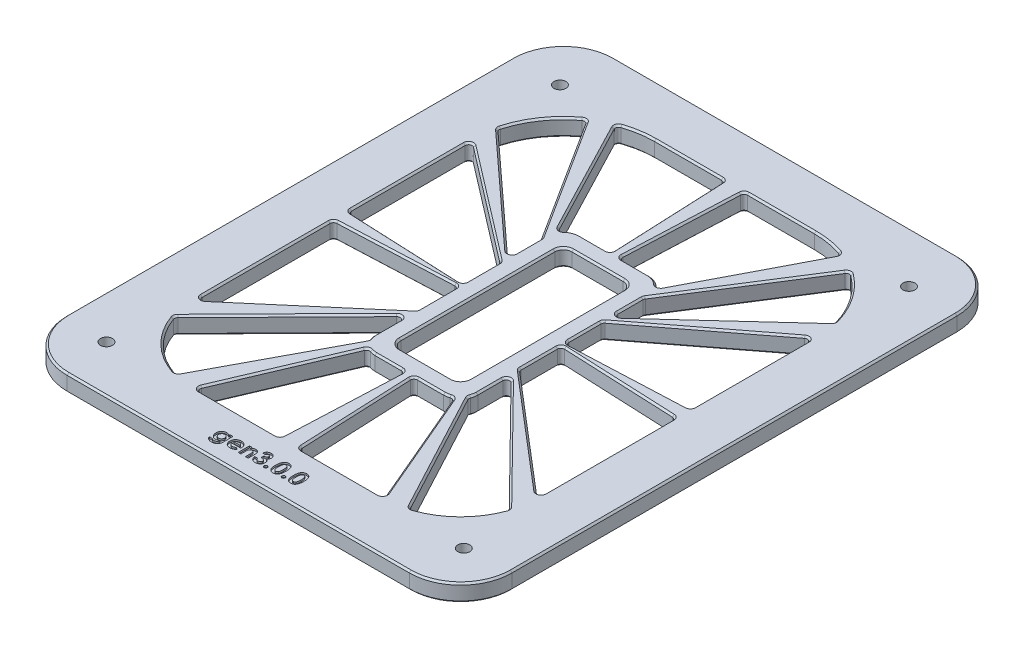
from build123d import *

# Parameters (mm, degrees)
SKETCH1_R           = 1.75
BOSS_EXTRUDE1_DEPTH = 5
CHAMFER1_SIZE       = 1.55
CUT_EXTRUDE1_REACH  = 174.772
CUT_EXTRUDE2_DEPTH  = 0.5
FILLET1_R           = 1
CHAMFER2_SIZE       = 0.5


with BuildPart() as part:
    # Sketch1 → Boss-Extrude1 (new body)
    with BuildSketch(Plane(origin=(0, 0, 0), x_dir=(1, 0, 0), z_dir=(0, 1, 0))):
        with BuildLine():
            Line((65, 15), (65, 145))
            ThreePointArc((65, 145), (60.606601718, 155.606601718), (50, 160))
            Line((50, 160), (-50, 160))
            ThreePointArc((-50, 160), (-60.606601718, 155.606601718), (-65, 145))
            Line((-65, 145), (-65, 15))
            ThreePointArc((-65, 15), (-60.606601718, 4.393398282), (-50, 0))
            Line((-50, 0), (50, 0))
            ThreePointArc((50, 0), (60.606601718, 4.393398282), (65, 15))
        make_face()
        with Locations((51, 145)):
            Circle(SKETCH1_R, mode=Mode.SUBTRACT)
        with Locations((-51, 145)):
            Circle(SKETCH1_R, mode=Mode.SUBTRACT)
        with Locations((52.22, 13.7)):
            Circle(SKETCH1_R, mode=Mode.SUBTRACT)
        with Locations((-52.22, 13.7)):
            Circle(SKETCH1_R, mode=Mode.SUBTRACT)
    extrude(amount=BOSS_EXTRUDE1_DEPTH)

    # Chamfer1
    chamfer1_edges = [part.edges().sort_by_distance(p)[0] for p in [
        (50.47, 0, -13.7),
        (49.25, 0, -145),
        (-53.97, 0, -13.7),
        (-52.75, 0, -145),
    ]]
    chamfer(chamfer1_edges, length=CHAMFER1_SIZE)

    # Sketch3 → Cut-Extrude1 (cut, up to next)
    with BuildSketch(Plane.XZ, mode=Mode.PRIVATE) as cut_extrude1_sk1:
        with BuildLine():
            Line((2.837961289, -15), (27.656991816, -15))
            Line((27.656991816, -15), (12.483721387, -50.66051523))
            ThreePointArc((12.483721387, -50.66051523), (11.285024542, -50.167949511), (10, -50))
            Line((10, -50), (1.309828287, -50))
            Line((1.309828287, -50), (2.837961289, -15))
        make_face()
    cut_extrude1_tool1 = extrude(cut_extrude1_sk1.sketch, amount=-CUT_EXTRUDE1_REACH, mode=Mode.PRIVATE) & part.part
    # Sketch3 → Cut-Extrude1 (cut, up to next)
    with BuildSketch(Plane.XZ, mode=Mode.PRIVATE) as cut_extrude1_sk2:
        with BuildLine():
            Line((14.491227741, -52.802530233), (34.123499961, -15.956229859))
            ThreePointArc((34.123499961, -15.956229859), (43.249886761, -21.34076953), (48.86906069, -30.324593208))
            Line((48.86906069, -30.324593208), (15, -64.752497974))
            Line((15, -64.752497974), (15, -55))
            ThreePointArc((15, -55), (14.871146616, -53.872200972), (14.491227741, -52.802530233))
        make_face()
    cut_extrude1_tool2 = extrude(cut_extrude1_sk2.sketch, amount=-CUT_EXTRUDE1_REACH, mode=Mode.PRIVATE) & part.part
    # Sketch3 → Cut-Extrude1 (cut, up to next)
    with BuildSketch(Plane.XZ, mode=Mode.PRIVATE) as cut_extrude1_sk3:
        Polygon((15, -67.202902455), (50, -37.343008184), (50, -77.816952855), (15, -79.345085856), align=None)
    cut_extrude1_tool3 = extrude(cut_extrude1_sk3.sketch, amount=-CUT_EXTRUDE1_REACH, mode=Mode.PRIVATE) & part.part
    # Sketch3 → Cut-Extrude1 (cut, up to next)
    with BuildSketch(Plane.XZ, mode=Mode.PRIVATE) as cut_extrude1_sk4:
        Polygon((50, -82.183047145), (15, -80.654914144), (15, -91.506745602), (50, -118.355818675), align=None)
    cut_extrude1_tool4 = extrude(cut_extrude1_sk4.sketch, amount=-CUT_EXTRUDE1_REACH, mode=Mode.PRIVATE) & part.part
    # Sketch3 → Cut-Extrude1 (cut, up to next)
    with BuildSketch(Plane.XZ, mode=Mode.PRIVATE) as cut_extrude1_sk5:
        with BuildLine():
            Line((49.151338462, -125.026917339), (15, -93.741309621))
            Line((15, -93.741309621), (15, -103.545283657))
            Line((15, -103.545283657), (38.431247686, -140.324975204))
            ThreePointArc((38.431247686, -140.324975204), (45.175907069, -133.646212422), (49.151338462, -125.026917339))
        make_face()
    cut_extrude1_tool5 = extrude(cut_extrude1_sk5.sketch, amount=-CUT_EXTRUDE1_REACH, mode=Mode.PRIVATE) & part.part
    # Sketch3 → Cut-Extrude1 (cut, up to next)
    with BuildSketch(Plane.XZ, mode=Mode.PRIVATE) as cut_extrude1_sk6:
        with BuildLine():
            Line((32.913718098, -143.226664199), (14.322471869, -107.513212474))
            ThreePointArc((14.322471869, -107.513212474), (12.493385011, -109.333939453), (10, -110))
            Line((10, -110), (1.309828287, -110))
            Line((1.309828287, -110), (2.837961289, -145))
            Line((2.837961289, -145), (23.355818675, -145))
            ThreePointArc((23.355818675, -145), (28.216326911, -144.552915044), (32.913718098, -143.226664199))
        make_face()
    cut_extrude1_tool6 = extrude(cut_extrude1_sk6.sketch, amount=-CUT_EXTRUDE1_REACH, mode=Mode.PRIVATE) & part.part
    # Sketch3 → Cut-Extrude1 (cut, up to next)
    with BuildSketch(Plane.XZ, mode=Mode.PRIVATE) as cut_extrude1_sk7:
        with BuildLine():
            Line((-7.5, -105), (7.5, -105))
            ThreePointArc((7.5, -105), (9.267766953, -104.267766953), (10, -102.5))
            Line((10, -102.5), (10, -57.5))
            ThreePointArc((10, -57.5), (9.267766953, -55.732233047), (7.5, -55))
            Line((7.5, -55), (-7.5, -55))
            ThreePointArc((-7.5, -55), (-9.267766953, -55.732233047), (-10, -57.5))
            Line((-10, -57.5), (-10, -102.5))
            ThreePointArc((-10, -102.5), (-9.267766953, -104.267766953), (-7.5, -105))
        make_face()
    cut_extrude1_tool7 = extrude(cut_extrude1_sk7.sketch, amount=-CUT_EXTRUDE1_REACH, mode=Mode.PRIVATE) & part.part
    # Sketch3 → Cut-Extrude1 (cut, up to next)
    with BuildSketch(Plane.XZ, mode=Mode.PRIVATE) as cut_extrude1_sk8:
        with BuildLine():
            Line((-32.913718098, -143.226664199), (-14.322471869, -107.513212474))
            ThreePointArc((-14.322471869, -107.513212474), (-12.493385011, -109.333939453), (-10, -110))
            Line((-10, -110), (-1.309828287, -110))
            Line((-1.309828287, -110), (-2.837961289, -145))
            Line((-2.837961289, -145), (-23.355818675, -145))
            ThreePointArc((-23.355818675, -145), (-28.216326911, -144.552915044), (-32.913718098, -143.226664199))
        make_face()
    cut_extrude1_tool8 = extrude(cut_extrude1_sk8.sketch, amount=-CUT_EXTRUDE1_REACH, mode=Mode.PRIVATE) & part.part
    # Sketch3 → Cut-Extrude1 (cut, up to next)
    with BuildSketch(Plane.XZ, mode=Mode.PRIVATE) as cut_extrude1_sk9:
        with BuildLine():
            Line((-15, -103.545283657), (-38.431247686, -140.324975204))
            ThreePointArc((-38.431247686, -140.324975204), (-45.175907069, -133.646212422), (-49.151338462, -125.026917339))
            Line((-49.151338462, -125.026917339), (-15, -93.741309621))
            Line((-15, -93.741309621), (-15, -103.545283657))
        make_face()
    cut_extrude1_tool9 = extrude(cut_extrude1_sk9.sketch, amount=-CUT_EXTRUDE1_REACH, mode=Mode.PRIVATE) & part.part
    # Sketch3 → Cut-Extrude1 (cut, up to next)
    with BuildSketch(Plane.XZ, mode=Mode.PRIVATE) as cut_extrude1_sk10:
        Polygon((-50, -82.183047145), (-50, -118.355818675), (-15, -91.506745602), (-15, -80.654914144), align=None)
    cut_extrude1_tool10 = extrude(cut_extrude1_sk10.sketch, amount=-CUT_EXTRUDE1_REACH, mode=Mode.PRIVATE) & part.part
    # Sketch3 → Cut-Extrude1 (cut, up to next)
    with BuildSketch(Plane.XZ, mode=Mode.PRIVATE) as cut_extrude1_sk11:
        Polygon((-15, -67.202902455), (-15, -79.345085856), (-50, -77.816952855), (-50, -37.343008184), align=None)
    cut_extrude1_tool11 = extrude(cut_extrude1_sk11.sketch, amount=-CUT_EXTRUDE1_REACH, mode=Mode.PRIVATE) & part.part
    # Sketch3 → Cut-Extrude1 (cut, up to next)
    with BuildSketch(Plane.XZ, mode=Mode.PRIVATE) as cut_extrude1_sk12:
        with BuildLine():
            Line((-14.491227741, -52.802530233), (-34.123499961, -15.956229859))
            ThreePointArc((-34.123499961, -15.956229859), (-43.249886761, -21.34076953), (-48.86906069, -30.324593208))
            Line((-48.86906069, -30.324593208), (-15, -64.752497974))
            Line((-15, -64.752497974), (-15, -55))
            ThreePointArc((-15, -55), (-14.871146616, -53.872200972), (-14.491227741, -52.802530233))
        make_face()
    cut_extrude1_tool12 = extrude(cut_extrude1_sk12.sketch, amount=-CUT_EXTRUDE1_REACH, mode=Mode.PRIVATE) & part.part
    # Sketch3 → Cut-Extrude1 (cut, up to next)
    with BuildSketch(Plane.XZ, mode=Mode.PRIVATE) as cut_extrude1_sk13:
        with BuildLine():
            Line((-2.837961289, -15), (-1.309828287, -50))
            Line((-1.309828287, -50), (-10, -50))
            ThreePointArc((-10, -50), (-11.285024542, -50.167949511), (-12.483721387, -50.66051523))
            Line((-12.483721387, -50.66051523), (-27.656991816, -15))
            Line((-27.656991816, -15), (-2.837961289, -15))
        make_face()
    cut_extrude1_tool13 = extrude(cut_extrude1_sk13.sketch, amount=-CUT_EXTRUDE1_REACH, mode=Mode.PRIVATE) & part.part
    add(cut_extrude1_tool1.solids().sort_by_distance((11.646845, 0, -30.37038))[0], mode=Mode.SUBTRACT)
    add(cut_extrude1_tool2.solids().sort_by_distance((31.031547, 0, -37.59902))[0], mode=Mode.SUBTRACT)
    add(cut_extrude1_tool3.solids().sort_by_distance((35.641026, 0, -64.01855))[0], mode=Mode.SUBTRACT)
    add(cut_extrude1_tool4.solids().sort_by_distance((35.641026, 0, -94.448468))[0], mode=Mode.SUBTRACT)
    add(cut_extrude1_tool5.solids().sort_by_distance((32.260679, 0, -118.743409))[0], mode=Mode.SUBTRACT)
    add(cut_extrude1_tool6.solids().sort_by_distance((13.869125, 0, -129.407337))[0], mode=Mode.SUBTRACT)
    add(cut_extrude1_tool7.solids().sort_by_distance((0, 0, -80))[0], mode=Mode.SUBTRACT)
    add(cut_extrude1_tool8.solids().sort_by_distance((-13.869125, 0, -129.407337))[0], mode=Mode.SUBTRACT)
    add(cut_extrude1_tool9.solids().sort_by_distance((-32.260679, 0, -118.743409))[0], mode=Mode.SUBTRACT)
    add(cut_extrude1_tool10.solids().sort_by_distance((-35.641026, 0, -94.448468))[0], mode=Mode.SUBTRACT)
    add(cut_extrude1_tool11.solids().sort_by_distance((-35.641026, 0, -64.01855))[0], mode=Mode.SUBTRACT)
    add(cut_extrude1_tool12.solids().sort_by_distance((-31.031547, 0, -37.59902))[0], mode=Mode.SUBTRACT)
    add(cut_extrude1_tool13.solids().sort_by_distance((-11.646845, 0, -30.37038))[0], mode=Mode.SUBTRACT)

    # Sketch4 → Cut-Extrude2 (cut)
    # profile 1 of 8: a face of its own
    with BuildSketch(Plane(origin=(0, 5, 0), x_dir=(1, 0, 0), z_dir=(0, 1, 0))):
        with BuildLine():
            Line((-10.673076923, 8.288461538), (-9.807692308, 8.288461538))
            Line((-9.807692308, 8.288461538), (-9.807692308, 5.483173077))
            add(Edge.make_bspline(
                [(-9.807692308, 5.483173077), (-9.808732275, 5.416135617), (-9.810740491, 5.286683649), (-9.826059743, 5.099074311), (-9.85160657, 4.925150135), (-9.888367551, 4.764664805), (-9.935846127, 4.618208179), (-9.993914226, 4.485293363), (-10.061391204, 4.365207569), (-10.116872299, 4.295038557), (-10.143930288, 4.260817308)],
                knots=[0, 0, 0, 0, 1.243822755, 2.401870584, 3.490053692, 4.503076575, 5.453444971, 6.342269266, 7.191528908, 8, 8, 8, 8], degree=3))
            add(Edge.make_bspline(
                [(-10.143930288, 4.260817308), (-10.182785936, 4.218197094), (-10.260300512, 4.133172442), (-10.396963056, 4.025874341), (-10.546681908, 3.934168581), (-10.710984972, 3.859011315), (-10.889676548, 3.801765455), (-11.082297592, 3.760538233), (-11.288970222, 3.734859978), (-11.431713478, 3.73215834), (-11.505108173, 3.730769231)],
                knots=[0, 0, 0, 0, 0.916003385, 1.827369254, 2.751972866, 3.703651841, 4.69362366, 5.730423306, 6.83304546, 8, 8, 8, 8], degree=3))
            add(Edge.make_bspline(
                [(-11.505108173, 3.730769231), (-11.582690613, 3.7319703), (-11.73190162, 3.734280267), (-11.946314763, 3.756877032), (-12.141624474, 3.794058451), (-12.318747927, 3.846404619), (-12.479335287, 3.913946314), (-12.626414826, 3.994932704), (-12.759704082, 4.091758599), (-12.881217785, 4.200606776), (-12.988137802, 4.323867598), (-13.079437007, 4.460412526), (-13.157219182, 4.608985621), (-13.195625016, 4.715232378), (-13.215144231, 4.769230769)],
                knots=[0, 0, 0, 0, 1.29412125, 2.488928388, 3.592140377, 4.607309753, 5.564519828, 6.493640275, 7.402258018, 8.307438948, 9.210158992, 10.116782752, 11.042881838, 12, 12, 12, 12], degree=3))
            Line((-13.215144231, 4.769230769), (-12.317307692, 4.769230769))
            add(Edge.make_bspline(
                [(-12.317307692, 4.769230769), (-12.29655965, 4.746389152), (-12.254799897, 4.700415645), (-12.180938275, 4.642078379), (-12.099230579, 4.592144523), (-12.009017596, 4.551256742), (-11.909923177, 4.520165251), (-11.802621873, 4.496544067), (-11.686633059, 4.483232294), (-11.606703854, 4.481606986), (-11.565504808, 4.480769231)],
                knots=[0, 0, 0, 0, 0.888971165, 1.789239437, 2.70354581, 3.646217955, 4.638595249, 5.694475788, 6.811630907, 8, 8, 8, 8], degree=3))
            add(Edge.make_bspline(
                [(-11.565504808, 4.480769231), (-11.513440047, 4.481742031), (-11.414000917, 4.483599995), (-11.273316485, 4.503914806), (-11.147682528, 4.534263946), (-11.038912634, 4.579938661), (-10.945071549, 4.634800279), (-10.866785233, 4.698529181), (-10.802143505, 4.768724367), (-10.759861051, 4.834760887), (-10.734735243, 4.894666717), (-10.717626067, 4.94639454), (-10.704633174, 5.006020244), (-10.692806214, 5.072427852), (-10.683965369, 5.146472916), (-10.678108196, 5.22799857), (-10.673029149, 5.316645631), (-10.673060646, 5.378296938), (-10.673076923, 5.41015625)],
                knots=[0, 0, 0, 0, 1.656375485, 3.163532, 4.516250129, 5.759907703, 6.905105653, 7.965920022, 8.961443813, 9.932912751, 10.442911961, 11.026787936, 11.664959534, 12.383728702, 13.174001396, 14.037595414, 14.985895623, 16, 16, 16, 16], degree=3))
            add(Edge.make_bspline(
                [(-10.673076923, 5.41015625), (-10.708461677, 5.375451387), (-10.77751125, 5.307728549), (-10.889602444, 5.221328788), (-11.00434763, 5.149964713), (-11.12240623, 5.093233398), (-11.246126163, 5.051678711), (-11.376234079, 5.021833902), (-11.514211746, 5.003648985), (-11.609018914, 5.001233811), (-11.657451923, 5)],
                knots=[0, 0, 0, 0, 1.082007397, 2.111422008, 3.08419067, 4.02964304, 4.965866572, 5.929243163, 6.942137121, 8, 8, 8, 8], degree=3))
            add(Edge.make_bspline(
                [(-11.657451923, 5), (-11.711024467, 5.001237627), (-11.816259942, 5.003668766), (-11.970829199, 5.027294684), (-12.119124655, 5.064054307), (-12.261545627, 5.11522714), (-12.396638864, 5.183166561), (-12.526326795, 5.263995522), (-12.648205923, 5.361958286), (-12.763957714, 5.471586253), (-12.868576847, 5.593442536), (-12.960635213, 5.724316018), (-13.038242725, 5.863303939), (-13.10135545, 6.010277093), (-13.151640159, 6.164618493), (-13.186246743, 6.327163707), (-13.207394055, 6.497638284), (-13.210138626, 6.613819888), (-13.211538462, 6.673076923)],
                knots=[0, 0, 0, 0, 1.007560175, 1.979205489, 2.935124557, 3.879618859, 4.820364716, 5.775815361, 6.749909327, 7.75781854, 8.772289371, 9.766897274, 10.764314289, 11.762244114, 12.772609037, 13.814079916, 14.885097635, 16, 16, 16, 16], degree=3))
            add(Edge.make_bspline(
                [(-13.211538462, 6.673076923), (-13.210315844, 6.73625295), (-13.20792639, 6.859722621), (-13.184502925, 7.040065842), (-13.148054879, 7.211342102), (-13.096024337, 7.373193129), (-13.027667881, 7.524927018), (-12.945061838, 7.667025234), (-12.848985453, 7.801112724), (-12.772932968, 7.880658381), (-12.734675481, 7.920673077)],
                knots=[0, 0, 0, 0, 1.104124469, 2.157873671, 3.173961494, 4.162551312, 5.124378318, 6.07778831, 7.033049473, 8, 8, 8, 8], degree=3))
            add(Edge.make_bspline(
                [(-12.734675481, 7.920673077), (-12.698369677, 7.954792672), (-12.626827277, 8.022027038), (-12.509712591, 8.108299888), (-12.38842026, 8.182296219), (-12.261286628, 8.241817925), (-12.129211292, 8.289217753), (-11.991412353, 8.322377695), (-11.848574984, 8.34282335), (-11.751571037, 8.345035395), (-11.702524038, 8.346153846)],
                knots=[0, 0, 0, 0, 1.042068658, 2.053448347, 3.038272799, 4.011764631, 4.986555969, 5.970496305, 6.973845226, 8, 8, 8, 8], degree=3))
            add(Edge.make_bspline(
                [(-11.702524038, 8.346153846), (-11.656498982, 8.344861479), (-11.565297416, 8.34230057), (-11.43017632, 8.32423228), (-11.299335079, 8.292312024), (-11.171341072, 8.248428382), (-11.044837668, 8.19158212), (-10.919934184, 8.117074144), (-10.794098241, 8.027983662), (-10.714250939, 7.958371916), (-10.673076923, 7.922475962)],
                knots=[0, 0, 0, 0, 0.968122651, 1.918396369, 2.861262201, 3.796768263, 4.761417965, 5.77287463, 6.85156174, 8, 8, 8, 8], degree=3))
            Line((-10.673076923, 7.922475962), (-10.673076923, 8.288461538))
        make_face()
        with BuildLine():
            add(Edge.make_bspline(
                [(-11.509615385, 7.596153846), (-11.541192356, 7.595136329), (-11.603359275, 7.5931331), (-11.694725021, 7.581846711), (-11.781431535, 7.560542568), (-11.864535567, 7.532879884), (-11.943026716, 7.495668094), (-12.017056718, 7.450266731), (-12.087503062, 7.397568276), (-12.152124109, 7.336578293), (-12.212023388, 7.270677223), (-12.262316912, 7.198149336), (-12.307137408, 7.123124492), (-12.341991993, 7.042583725), (-12.370813678, 6.958712743), (-12.388428301, 6.869804814), (-12.40250293, 6.777485003), (-12.403392597, 6.71430221), (-12.403846154, 6.682091346)],
                knots=[0, 0, 0, 0, 1.059154978, 2.085203149, 3.079850876, 4.048488546, 5.017545358, 5.985239295, 6.956545898, 7.961752598, 8.960830395, 9.936516972, 10.916356752, 11.886198968, 12.873933111, 13.883774911, 14.921139228, 16, 16, 16, 16], degree=3))
            add(Edge.make_bspline(
                [(-12.403846154, 6.682091346), (-12.403355197, 6.648688231), (-12.402391634, 6.583130503), (-12.38890087, 6.487625138), (-12.369629512, 6.396220756), (-12.340518538, 6.310033114), (-12.304074287, 6.227929753), (-12.260296282, 6.14995102), (-12.206254782, 6.077961349), (-12.146243539, 6.010376459), (-12.07985489, 5.949271986), (-12.008393383, 5.896124225), (-11.933330278, 5.850225662), (-11.853042958, 5.814439359), (-11.769268589, 5.785440043), (-11.681166933, 5.764380744), (-11.588940449, 5.753002524), (-11.526170461, 5.751011301), (-11.494290865, 5.75)],
                knots=[0, 0, 0, 0, 1.097915424, 2.154794285, 3.166904039, 4.167166757, 5.140698173, 6.119085138, 7.101657521, 8.095747232, 9.089148684, 10.06378348, 11.021581144, 11.977080764, 12.949256321, 13.934658686, 14.951055324, 16, 16, 16, 16], degree=3))
            add(Edge.make_bspline(
                [(-11.494290865, 5.75), (-11.462988934, 5.750490789), (-11.401615742, 5.751453072), (-11.312089607, 5.764952016), (-11.226554752, 5.784470347), (-11.145165223, 5.812381608), (-11.068372715, 5.848811861), (-10.995146758, 5.892285844), (-10.927040622, 5.94489431), (-10.86276266, 6.0043718), (-10.804755902, 6.070509194), (-10.753555353, 6.142168193), (-10.711495956, 6.219361737), (-10.675669954, 6.300867687), (-10.649144308, 6.38783578), (-10.629003915, 6.479402408), (-10.617189677, 6.576011161), (-10.615994069, 6.642095273), (-10.615384615, 6.67578125)],
                knots=[0, 0, 0, 0, 1.047368431, 2.053558439, 3.025081491, 3.983010266, 4.928381778, 5.867249904, 6.829345556, 7.804873619, 8.796055618, 9.770545002, 10.747991713, 11.735078325, 12.747239243, 13.787476531, 14.872179528, 16, 16, 16, 16], degree=3))
            add(Edge.make_bspline(
                [(-10.615384615, 6.67578125), (-10.615975897, 6.709169678), (-10.617130405, 6.774362259), (-10.629111477, 6.869743499), (-10.649076838, 6.960161556), (-10.675969908, 7.046362656), (-10.711017596, 7.127832024), (-10.754967244, 7.203811405), (-10.805225533, 7.27570379), (-10.864402924, 7.341060333), (-10.928187382, 7.401509014), (-10.998508157, 7.452647307), (-11.071848474, 7.497831257), (-11.150684582, 7.533651494), (-11.234037255, 7.561864434), (-11.322040366, 7.581163691), (-11.4142451, 7.594706261), (-11.477412413, 7.595665051), (-11.509615385, 7.596153846)],
                knots=[0, 0, 0, 0, 1.111098411, 2.169475416, 3.193737863, 4.190319778, 5.171520483, 6.139320596, 7.107999188, 8.085777416, 9.069626166, 10.027970922, 10.974971434, 11.932846196, 12.904000912, 13.89897495, 14.928888274, 16, 16, 16, 16], degree=3))
        make_face(mode=Mode.SUBTRACT)
    # profile 2 of 8: a face of its own
    with BuildSketch(Plane(origin=(0, 5, 0), x_dir=(1, 0, 0), z_dir=(0, 1, 0))):
        with BuildLine():
            Line((-5.714242788, 6.442307692), (-8.307692308, 6.442307692))
            add(Edge.make_bspline(
                [(-8.307692308, 6.442307692), (-8.302404474, 6.41217328), (-8.292013462, 6.352956783), (-8.269449012, 6.266939682), (-8.240653389, 6.185878619), (-8.206143648, 6.109665233), (-8.166501624, 6.037896615), (-8.120262486, 5.970909388), (-8.068012738, 5.908762719), (-8.010054472, 5.851726704), (-7.947353747, 5.800621199), (-7.88021464, 5.755849546), (-7.808567866, 5.719139529), (-7.733234829, 5.688196794), (-7.653652619, 5.663687013), (-7.569704108, 5.646783084), (-7.481611834, 5.63679787), (-7.421600686, 5.635353624), (-7.390925481, 5.634615385)],
                knots=[0, 0, 0, 0, 1.091296461, 2.144483647, 3.168565212, 4.157007626, 5.126487748, 6.090021542, 7.05641414, 8.019231907, 8.98705074, 9.938580405, 10.892824166, 11.854447369, 12.841318655, 13.858982407, 14.905600794, 16, 16, 16, 16], degree=3))
            add(Edge.make_bspline(
                [(-7.390925481, 5.634615385), (-7.353898426, 5.635592935), (-7.280981251, 5.637518019), (-7.174157047, 5.654590653), (-7.070842481, 5.680378117), (-6.972015273, 5.718726241), (-6.876530664, 5.766462914), (-6.785960625, 5.825936934), (-6.698737459, 5.895410277), (-6.645521049, 5.948960304), (-6.618389423, 5.976262019)],
                knots=[0, 0, 0, 0, 1.021034703, 2.010718019, 2.977989445, 3.954245119, 4.929443971, 5.918328161, 6.938689359, 8, 8, 8, 8], degree=3))
            Line((-6.618389423, 5.976262019), (-5.942307692, 5.654447115))
            add(Edge.make_bspline(
                [(-5.942307692, 5.654447115), (-5.963593731, 5.625033077), (-6.005771234, 5.566750241), (-6.074624592, 5.484731239), (-6.146477456, 5.408204182), (-6.221383412, 5.337672401), (-6.299437461, 5.273336884), (-6.380422476, 5.214413907), (-6.465522018, 5.16248553), (-6.553034538, 5.115039488), (-6.644769083, 5.074364216), (-6.74047178, 5.039677781), (-6.839737277, 5.008321538), (-6.943819082, 4.984429798), (-7.051850507, 4.965517292), (-7.164089983, 4.952086908), (-7.280522719, 4.943791602), (-7.359661372, 4.942808204), (-7.399939904, 4.942307692)],
                knots=[0, 0, 0, 0, 1.028154879, 2.037251081, 3.030720504, 4.000128189, 4.949298328, 5.894184978, 6.834267904, 7.770992897, 8.712077017, 9.673380525, 10.653304757, 11.658697181, 12.695551717, 13.758623199, 14.859225354, 16, 16, 16, 16], degree=3))
            add(Edge.make_bspline(
                [(-7.399939904, 4.942307692), (-7.461907764, 4.943571031), (-7.583268248, 4.946045206), (-7.760779894, 4.969009092), (-7.929366722, 5.007085691), (-8.089504765, 5.058844978), (-8.240501797, 5.127183453), (-8.382432548, 5.210767077), (-8.516715109, 5.307993385), (-8.639246399, 5.420902897), (-8.750876019, 5.543798188), (-8.848924536, 5.675779339), (-8.930970139, 5.815924247), (-8.998347639, 5.963305404), (-9.050715772, 6.118300048), (-9.088470158, 6.280975814), (-9.11161405, 6.451255007), (-9.114113705, 6.567234146), (-9.115384615, 6.626201923)],
                knots=[0, 0, 0, 0, 1.103565453, 2.161269334, 3.182010356, 4.179077853, 5.15417608, 6.128274628, 7.109042802, 8.101804412, 9.090965879, 10.063106201, 11.02526161, 11.978650795, 12.945248442, 13.93468508, 14.949922959, 16, 16, 16, 16], degree=3))
            add(Edge.make_bspline(
                [(-9.115384615, 6.626201923), (-9.114101196, 6.686668147), (-9.111576127, 6.805632728), (-9.088669427, 6.979843746), (-9.050611394, 7.146064619), (-8.998090073, 7.304524253), (-8.931734698, 7.45571824), (-8.848645205, 7.598323815), (-8.750924675, 7.732837453), (-8.639697199, 7.858629884), (-8.516646829, 7.972171297), (-8.385894185, 8.073359386), (-8.245970128, 8.157676018), (-8.098457319, 8.225803805), (-7.944299303, 8.281155911), (-7.781714229, 8.317988116), (-7.611939121, 8.342718736), (-7.495884596, 8.344996272), (-7.436899038, 8.346153846)],
                knots=[0, 0, 0, 0, 1.079208495, 2.12329425, 3.130605359, 4.119693003, 5.099659317, 6.073216462, 7.060498243, 8.06384408, 9.066070512, 10.045757761, 11.010926815, 11.975797609, 12.942977511, 13.929384301, 14.947594487, 16, 16, 16, 16], degree=3))
            add(Edge.make_bspline(
                [(-7.436899038, 8.346153846), (-7.37463431, 8.344870908), (-7.252383932, 8.342351992), (-7.073635972, 8.319574567), (-6.903929747, 8.281265782), (-6.742542213, 8.229954047), (-6.591534356, 8.15988927), (-6.447588074, 8.078362507), (-6.314156015, 7.979034579), (-6.189815937, 7.86667761), (-6.077573604, 7.742021446), (-5.979461369, 7.606606672), (-5.895979933, 7.461754858), (-5.8283174, 7.306878598), (-5.776003039, 7.142442846), (-5.738213704, 6.968661154), (-5.715246345, 6.78487254), (-5.712793203, 6.659021942), (-5.711538462, 6.594651442)],
                knots=[0, 0, 0, 0, 1.080001299, 2.120471247, 3.119684163, 4.095710327, 5.052285597, 6.002875087, 6.961153713, 7.931888285, 8.906493152, 9.865905668, 10.82813294, 11.801621613, 12.7925306, 13.817193356, 14.883530496, 16, 16, 16, 16], degree=3))
            Line((-5.711538462, 6.594651442), (-5.714242788, 6.442307692))
        make_face()
        with BuildLine():
            add(Edge.make_bspline(
                [(-6.519230769, 7.076923077), (-6.534472417, 7.11805411), (-6.564776783, 7.19983332), (-6.633233086, 7.312668674), (-6.724072409, 7.410388673), (-6.829725058, 7.496900964), (-6.950439826, 7.567119742), (-7.082412778, 7.617960419), (-7.223975801, 7.648445126), (-7.321363533, 7.652020447), (-7.37109375, 7.653846154)],
                knots=[0, 0, 0, 0, 0.954238005, 1.897273737, 2.851915805, 3.847685534, 4.862635127, 5.880135777, 6.917509367, 8, 8, 8, 8], degree=3))
            add(Edge.make_bspline(
                [(-7.37109375, 7.653846154), (-7.425407244, 7.65209234), (-7.531578814, 7.648663999), (-7.684724077, 7.612202334), (-7.82918217, 7.557784387), (-7.914346475, 7.501678329), (-7.95703125, 7.473557692)],
                knots=[0, 0, 0, 0, 1.044195649, 2.041185066, 3.018232172, 4, 4, 4, 4], degree=3))
            add(Edge.make_bspline(
                [(-7.95703125, 7.473557692), (-7.983663362, 7.4521404), (-8.040441662, 7.406479826), (-8.114179804, 7.315391317), (-8.186812488, 7.205103581), (-8.228108173, 7.121332254), (-8.25, 7.076923077)],
                knots=[0, 0, 0, 0, 0.82159062, 1.751589201, 2.808063854, 4, 4, 4, 4], degree=3))
            Line((-8.25, 7.076923077), (-6.519230769, 7.076923077))
        make_face(mode=Mode.SUBTRACT)
    # profile 3 of 8: a face of its own
    with BuildSketch(Plane(origin=(0, 5, 0), x_dir=(1, 0, 0), z_dir=(0, 1, 0))):
        with BuildLine():
            Line((-5.019230769, 8.288461538), (-4.211538462, 8.288461538))
            Line((-4.211538462, 8.288461538), (-4.211538462, 7.940504808))
            add(Edge.make_bspline(
                [(-4.211538462, 7.940504808), (-4.165460016, 7.976345572), (-4.077395148, 8.044844239), (-3.943521345, 8.13218039), (-3.81716105, 8.203661521), (-3.695497556, 8.258033728), (-3.576241762, 8.297152193), (-3.457462234, 8.325256476), (-3.337390105, 8.343252422), (-3.256672489, 8.345187224), (-3.216346154, 8.346153846)],
                knots=[0, 0, 0, 0, 1.276643801, 2.439914479, 3.493451431, 4.44993799, 5.350072675, 6.235028322, 7.118224225, 8, 8, 8, 8], degree=3))
            add(Edge.make_bspline(
                [(-3.216346154, 8.346153846), (-3.175440514, 8.345049197), (-3.095139307, 8.342880677), (-2.976900205, 8.327713638), (-2.863934226, 8.300089657), (-2.754971161, 8.263412481), (-2.651120066, 8.215000711), (-2.551108704, 8.15751959), (-2.457085282, 8.087503695), (-2.399181496, 8.034182952), (-2.369891827, 8.007211538)],
                knots=[0, 0, 0, 0, 1.048836932, 2.058954983, 3.049370783, 4.026390553, 5.001981509, 5.982488534, 6.97947532, 8, 8, 8, 8], degree=3))
            add(Edge.make_bspline(
                [(-2.369891827, 8.007211538), (-2.346400434, 7.982216926), (-2.29924572, 7.932044769), (-2.239907437, 7.846187359), (-2.188988516, 7.752587067), (-2.147267535, 7.650164182), (-2.116437411, 7.53835596), (-2.092719376, 7.418512881), (-2.079410773, 7.289963914), (-2.077767764, 7.201651987), (-2.076923077, 7.15625)],
                knots=[0, 0, 0, 0, 0.889584746, 1.785680191, 2.700364693, 3.65222533, 4.649950538, 5.707241244, 6.821271309, 8, 8, 8, 8], degree=3))
            Line((-2.076923077, 7.15625), (-2.076923077, 5))
            Line((-2.076923077, 5), (-2.884615385, 5))
            Line((-2.884615385, 5), (-2.884615385, 6.427884615))
            add(Edge.make_bspline(
                [(-2.884615385, 6.427884615), (-2.884786194, 6.474459724), (-2.885113518, 6.563712275), (-2.887626641, 6.691446089), (-2.892533722, 6.806806311), (-2.897006398, 6.910002978), (-2.90578804, 7.000669674), (-2.913707467, 7.079380387), (-2.925859059, 7.145421048), (-2.941670252, 7.216457688), (-2.969280488, 7.292515401), (-3.012144035, 7.372654768), (-3.066522454, 7.440734946), (-3.130194715, 7.497233212), (-3.203090496, 7.541928523), (-3.284328957, 7.573374458), (-3.373474565, 7.592972337), (-3.435590177, 7.595066361), (-3.467848558, 7.596153846)],
                knots=[0, 0, 0, 0, 1.49886392, 2.872294502, 4.110984203, 5.214877267, 6.195405875, 7.042225351, 7.75923308, 8.355011229, 9.382752534, 10.352059385, 11.267231453, 12.171456522, 13.078624015, 14.003401117, 14.963110155, 16, 16, 16, 16], degree=3))
            add(Edge.make_bspline(
                [(-3.467848558, 7.596153846), (-3.509801939, 7.594026379), (-3.591870908, 7.58986464), (-3.710567254, 7.558481328), (-3.81958787, 7.505107552), (-3.918041968, 7.43124898), (-4.004991855, 7.340061419), (-4.076606089, 7.231309794), (-4.135344473, 7.107618816), (-4.160602851, 7.017304311), (-4.173677885, 6.970552885)],
                knots=[0, 0, 0, 0, 0.984188326, 1.925263693, 2.85911992, 3.81709677, 4.80007086, 5.801799564, 6.862098548, 8, 8, 8, 8], degree=3))
            add(Edge.make_bspline(
                [(-4.173677885, 6.970552885), (-4.17692755, 6.955870286), (-4.184174957, 6.923125139), (-4.190135033, 6.867805791), (-4.19842593, 6.802174742), (-4.201532326, 6.725044253), (-4.206934006, 6.636779352), (-4.208931805, 6.537263265), (-4.210933179, 6.426691126), (-4.211330017, 6.349460689), (-4.211538462, 6.308894231)],
                knots=[0, 0, 0, 0, 0.543362196, 1.211806945, 2.009705693, 2.934833164, 4.000995085, 5.207458376, 6.533175157, 8, 8, 8, 8], degree=3))
            Line((-4.211538462, 6.308894231), (-4.211538462, 5))
            Line((-4.211538462, 5), (-5.019230769, 5))
            Line((-5.019230769, 5), (-5.019230769, 8.288461538))
        make_face()
    # profile 4 of 8: a face of its own
    with BuildSketch(Plane(origin=(0, 5, 0), x_dir=(1, 0, 0), z_dir=(0, 1, 0))):
        with BuildLine():
            Line((-0.461538462, 8.403846154), (-1.269230769, 8.403846154))
            add(Edge.make_bspline(
                [(-1.269230769, 8.403846154), (-1.263528154, 8.444219811), (-1.252348556, 8.523369691), (-1.225597271, 8.637959), (-1.193599848, 8.746654803), (-1.1536527, 8.84911288), (-1.106801194, 8.945515745), (-1.053521759, 9.036194204), (-0.993238422, 9.120759049), (-0.947030605, 9.171701247), (-0.923978365, 9.197115385)],
                knots=[0, 0, 0, 0, 1.111473889, 2.178970933, 3.205615836, 4.199322666, 5.174200091, 6.12565194, 7.064921805, 8, 8, 8, 8], degree=3))
            add(Edge.make_bspline(
                [(-0.923978365, 9.197115385), (-0.890728564, 9.230647497), (-0.825196699, 9.296735767), (-0.715685267, 9.381387541), (-0.600897062, 9.454647894), (-0.478529957, 9.512729232), (-0.350488075, 9.559739346), (-0.215753183, 9.591316146), (-0.074875857, 9.612267632), (0.021255195, 9.614331426), (0.0703125, 9.615384615)],
                knots=[0, 0, 0, 0, 1.01925491, 2.00884431, 2.983262333, 3.955970413, 4.92937149, 5.924503185, 6.940838805, 8, 8, 8, 8], degree=3))
            add(Edge.make_bspline(
                [(0.0703125, 9.615384615), (0.113926968, 9.614354963), (0.199664224, 9.612330875), (0.325676418, 9.59608259), (0.445818498, 9.567584907), (0.561360404, 9.530324827), (0.670602888, 9.47962626), (0.775957039, 9.420776015), (0.874479259, 9.348593745), (0.96640007, 9.267035043), (1.050846867, 9.178821322), (1.123978163, 9.08452811), (1.18685045, 8.986674194), (1.238648899, 8.884446595), (1.278474867, 8.77767233), (1.30611527, 8.66696822), (1.324206585, 8.552578543), (1.326008952, 8.474829419), (1.326923077, 8.435396635)],
                knots=[0, 0, 0, 0, 1.091422571, 2.145516843, 3.172569842, 4.178562979, 5.178154469, 6.181868002, 7.194278174, 8.227918432, 9.254613415, 10.245994977, 11.209837596, 12.161663635, 13.10878368, 14.055455738, 15.013766427, 16, 16, 16, 16], degree=3))
            add(Edge.make_bspline(
                [(1.326923077, 8.435396635), (1.325047239, 8.386562414), (1.32135429, 8.290422848), (1.291050975, 8.14971545), (1.243618046, 8.015174067), (1.175096566, 7.888681136), (1.089427265, 7.770580899), (0.984313901, 7.664821802), (0.862750376, 7.569745685), (0.771491019, 7.518651769), (0.724759615, 7.492487981)],
                knots=[0, 0, 0, 0, 0.992805628, 1.954529043, 2.915727527, 3.886831945, 4.871318353, 5.87440735, 6.911542536, 8, 8, 8, 8], degree=3))
            add(Edge.make_bspline(
                [(0.724759615, 7.492487981), (0.756835334, 7.481956847), (0.819862683, 7.461263641), (0.90944848, 7.420508607), (0.994634337, 7.37597011), (1.073953384, 7.324228117), (1.148194543, 7.267374845), (1.216905232, 7.204924292), (1.280495983, 7.137012629), (1.3379287, 7.063266368), (1.388902481, 6.984864936), (1.43463854, 6.90361936), (1.472281867, 6.818297537), (1.50417045, 6.729873899), (1.528448603, 6.637553741), (1.545542591, 6.541694796), (1.555423336, 6.442515725), (1.556930318, 6.375321964), (1.557692308, 6.341346154)],
                knots=[0, 0, 0, 0, 1.059543567, 2.081955587, 3.086750234, 4.076226789, 5.052108497, 6.020845489, 6.989030705, 7.970690546, 8.952259656, 9.923888338, 10.895517021, 11.877585046, 12.873342345, 13.889638361, 14.932918083, 16, 16, 16, 16], degree=3))
            add(Edge.make_bspline(
                [(1.557692308, 6.341346154), (1.556147653, 6.291415507), (1.553101907, 6.192962441), (1.533738485, 6.047951149), (1.497687281, 5.909695767), (1.450259926, 5.776605456), (1.386996981, 5.650398364), (1.31254713, 5.528178212), (1.221033305, 5.414183559), (1.119331402, 5.305400683), (1.00638551, 5.206500163), (0.883933788, 5.120757862), (0.754668845, 5.047175713), (0.617772858, 4.987439628), (0.473293389, 4.94143601), (0.321552468, 4.908182475), (0.161912523, 4.887837412), (0.052945771, 4.885704618), (-0.002704327, 4.884615385)],
                knots=[0, 0, 0, 0, 1.005138573, 1.981928558, 2.936866704, 3.876260664, 4.820238198, 5.773547, 6.751179199, 7.756627054, 8.768222608, 9.766606018, 10.760583154, 11.757261445, 12.767156078, 13.807575856, 14.880313354, 16, 16, 16, 16], degree=3))
            add(Edge.make_bspline(
                [(-0.002704327, 4.884615385), (-0.055348422, 4.885763797), (-0.158286983, 4.888009365), (-0.308856173, 4.907445895), (-0.451957936, 4.938798595), (-0.587957469, 4.982992826), (-0.716328602, 5.040305191), (-0.838235453, 5.108551359), (-0.9512454, 5.191667608), (-1.056617594, 5.285901916), (-1.152014562, 5.391627458), (-1.237276987, 5.506395155), (-1.310524816, 5.630641423), (-1.372058439, 5.763835428), (-1.421396804, 5.906210833), (-1.460314761, 6.057478112), (-1.487499591, 6.217932792), (-1.495778788, 6.328329025), (-1.5, 6.384615385)],
                knots=[0, 0, 0, 0, 1.066544725, 2.085487077, 3.070979577, 4.031932826, 4.977951092, 5.916076795, 6.857635327, 7.814973522, 8.776389752, 9.738577119, 10.707772778, 11.69409279, 12.707140348, 13.757286496, 14.856535458, 16, 16, 16, 16], degree=3))
            Line((-1.5, 6.384615385), (-0.692307692, 6.384615385))
            add(Edge.make_bspline(
                [(-0.692307692, 6.384615385), (-0.68718943, 6.356313864), (-0.677220273, 6.301189231), (-0.657776043, 6.221381017), (-0.632437499, 6.147713106), (-0.603139837, 6.07953074), (-0.571493952, 6.015938708), (-0.533258155, 5.959285621), (-0.491234164, 5.908033115), (-0.430593239, 5.847103572), (-0.343902861, 5.784501009), (-0.22684213, 5.730096405), (-0.096623152, 5.698208622), (-0.0055871, 5.694318411), (0.041466346, 5.692307692)],
                knots=[0, 0, 0, 0, 0.928156231, 1.807827665, 2.648129825, 3.438902246, 4.202261636, 4.936546065, 5.639352463, 6.338805438, 7.70633318, 9.064371875, 10.482673459, 12, 12, 12, 12], degree=3))
            add(Edge.make_bspline(
                [(0.041466346, 5.692307692), (0.066434568, 5.692735856), (0.115341728, 5.693574532), (0.187179063, 5.702870139), (0.25561424, 5.71818001), (0.320774723, 5.738985558), (0.383075326, 5.765066612), (0.441325735, 5.798696572), (0.496713239, 5.8377962), (0.548635725, 5.881754562), (0.596613172, 5.929653441), (0.636533229, 5.982693312), (0.673017273, 6.0365913), (0.700001134, 6.094873603), (0.72364481, 6.154404009), (0.738115948, 6.217343287), (0.749042696, 6.282371138), (0.749677715, 6.326873345), (0.75, 6.349459135)],
                knots=[0, 0, 0, 0, 1.110435564, 2.175094844, 3.216326037, 4.226890168, 5.215276772, 6.21526065, 7.213097102, 8.228249917, 9.239874822, 10.221364777, 11.178138315, 12.128914389, 13.072518965, 14.022636769, 14.996447288, 16, 16, 16, 16], degree=3))
            add(Edge.make_bspline(
                [(0.75, 6.349459135), (0.749144393, 6.374160544), (0.747441076, 6.42333539), (0.733524799, 6.495095737), (0.711548055, 6.564123407), (0.681019673, 6.630112714), (0.640252422, 6.692820434), (0.59214752, 6.753504673), (0.532915098, 6.809006925), (0.467929197, 6.863869219), (0.392571082, 6.911692593), (0.310510799, 6.955826541), (0.219591676, 6.990943538), (0.12203313, 7.022309521), (0.015989749, 7.045218747), (-0.097879975, 7.061853079), (-0.219392355, 7.07423476), (-0.303152418, 7.076011117), (-0.346153846, 7.076923077)],
                knots=[0, 0, 0, 0, 0.809814727, 1.612155564, 2.388397, 3.182215007, 3.988903953, 4.837162975, 5.715530372, 6.646997145, 7.623086902, 8.637258368, 9.698941581, 10.815059213, 11.996518529, 13.252603015, 14.589518788, 16, 16, 16, 16], degree=3))
            Line((-0.346153846, 7.076923077), (-0.346153846, 7.826923077))
            add(Edge.make_bspline(
                [(-0.346153846, 7.826923077), (-0.29261451, 7.831482658), (-0.192453016, 7.840012731), (-0.053423491, 7.859960604), (0.063621447, 7.886624221), (0.161494976, 7.918792431), (0.242762883, 7.960104794), (0.313758078, 8.005711818), (0.374902498, 8.058677711), (0.426577735, 8.117423038), (0.467916317, 8.18051001), (0.497173357, 8.246958069), (0.516493178, 8.31471123), (0.518323729, 8.36105235), (0.519230769, 8.384014423)],
                knots=[0, 0, 0, 0, 1.70044513, 3.18119609, 4.440695891, 5.496282586, 6.431922213, 7.318171381, 8.16090191, 8.983045123, 9.787564368, 10.536848927, 11.275007137, 12, 12, 12, 12], degree=3))
            add(Edge.make_bspline(
                [(0.519230769, 8.384014423), (0.517665865, 8.413311535), (0.514611504, 8.470493294), (0.490889681, 8.552332438), (0.449711283, 8.625285251), (0.394498282, 8.689198221), (0.32721932, 8.742583123), (0.248356583, 8.781339652), (0.159621397, 8.804110844), (0.097191412, 8.806471449), (0.064903846, 8.807692308)],
                knots=[0, 0, 0, 0, 1.009664648, 1.970651636, 2.907870547, 3.878035693, 4.867062054, 5.849714035, 6.887914197, 8, 8, 8, 8], degree=3))
            add(Edge.make_bspline(
                [(0.064903846, 8.807692308), (0.035638798, 8.806251823), (-0.022432021, 8.803393459), (-0.10734894, 8.782059391), (-0.187991722, 8.746146143), (-0.262690482, 8.69662389), (-0.330366929, 8.637149763), (-0.385909766, 8.566715005), (-0.432107664, 8.489539484), (-0.451689737, 8.432522577), (-0.461538462, 8.403846154)],
                knots=[0, 0, 0, 0, 0.98818071, 1.960853194, 2.938124878, 3.957524365, 4.978590984, 5.968022688, 6.978025184, 8, 8, 8, 8], degree=3))
        make_face()
    # profile 5 of 8: a face of its own
    with BuildSketch(Plane(origin=(0, 5, 0), x_dir=(1, 0, 0), z_dir=(0, 1, 0))):
        with BuildLine():
            add(Edge.make_bspline(
                [(2.625, 5.923076923), (2.657605581, 5.921289237), (2.721800338, 5.917769593), (2.81455301, 5.891502856), (2.89826283, 5.84431092), (2.973110594, 5.782757219), (3.036399979, 5.708699899), (3.082144114, 5.624246579), (3.110630135, 5.531851297), (3.113775012, 5.467454575), (3.115384615, 5.434495192)],
                knots=[0, 0, 0, 0, 1.016957001, 2.002212695, 2.9757545, 3.99499976, 5.013036768, 5.994806404, 6.97370641, 8, 8, 8, 8], degree=3))
            add(Edge.make_bspline(
                [(3.115384615, 5.434495192), (3.113785556, 5.401530516), (3.110661282, 5.337123452), (3.081946994, 5.24454813), (3.036468335, 5.159400682), (2.973105516, 5.084549789), (2.8985728, 5.021836051), (2.814360546, 4.975079294), (2.72197703, 4.947322511), (2.657636681, 4.943995381), (2.625, 4.942307692)],
                knots=[0, 0, 0, 0, 1.023218912, 1.999186227, 2.986238111, 4.008388923, 5.030539734, 6.0011649, 6.986089706, 8, 8, 8, 8], degree=3))
            add(Edge.make_bspline(
                [(2.625, 4.942307692), (2.592355586, 4.943981657), (2.527999991, 4.947281732), (2.435472872, 4.975313256), (2.350638897, 5.021523885), (2.276087455, 5.08462586), (2.212441559, 5.159135629), (2.1682559, 5.244816786), (2.139274147, 5.33708855), (2.136192583, 5.4015187), (2.134615385, 5.434495192)],
                knots=[0, 0, 0, 0, 1.013427518, 1.99788335, 2.976245624, 3.997909735, 5.019573847, 6.001765691, 6.977268297, 8, 8, 8, 8], degree=3))
            add(Edge.make_bspline(
                [(2.134615385, 5.434495192), (2.136202989, 5.467466596), (2.139304883, 5.531886806), (2.168059341, 5.623974829), (2.212512374, 5.708966392), (2.276082147, 5.782680989), (2.350950464, 5.844620649), (2.435279328, 5.891272099), (2.528176594, 5.917810673), (2.592386649, 5.921303075), (2.625, 5.923076923)],
                knots=[0, 0, 0, 0, 1.025808215, 2.00424526, 2.981110158, 3.998665696, 5.017428914, 5.998734231, 6.983523959, 8, 8, 8, 8], degree=3))
        make_face()
    # profile 6 of 8: a face of its own
    with BuildSketch(Plane(origin=(0, 5, 0), x_dir=(1, 0, 0), z_dir=(0, 1, 0))):
        with BuildLine():
            add(Edge.make_bspline(
                [(5.207632212, 9.615384615), (5.246727872, 9.614804229), (5.323600385, 9.613663035), (5.436819127, 9.601302973), (5.545880078, 9.582630367), (5.651209899, 9.556588592), (5.752050415, 9.522123231), (5.849135563, 9.480868784), (5.941309751, 9.430661371), (6.029748492, 9.37394952), (6.114417721, 9.309743665), (6.193282472, 9.236545675), (6.267782982, 9.156039839), (6.336306591, 9.067009053), (6.400370773, 8.970263146), (6.459765026, 8.865786778), (6.51403467, 8.753068607), (6.563787941, 8.631905224), (6.608277472, 8.500480442), (6.645750949, 8.357286761), (6.677890726, 8.202291482), (6.705018966, 8.035108798), (6.72552353, 7.855516482), (6.73934402, 7.663633847), (6.748828293, 7.459830814), (6.749602334, 7.320023608), (6.75, 7.248197115)],
                knots=[0, 0, 0, 0, 0.879237366, 1.728815576, 2.559023295, 3.367336655, 4.166867292, 4.954216142, 5.737608147, 6.525189134, 7.316157332, 8.124696809, 8.942788509, 9.781158001, 10.649253743, 11.551476218, 12.482711956, 13.461909668, 14.496590415, 15.601789533, 16.789733467, 18.056700938, 19.410929216, 20.8549011, 22.384193279, 24, 24, 24, 24], degree=3))
            add(Edge.make_bspline(
                [(6.75, 7.248197115), (6.74957023, 7.175471993), (6.748735195, 7.034168383), (6.739738284, 6.828501265), (6.724245176, 6.635225446), (6.704276542, 6.454360924), (6.676924974, 6.286003211), (6.644892487, 6.129716371), (6.606827502, 5.985557057), (6.5608725, 5.853850089), (6.511420387, 5.732473916), (6.457002292, 5.619975519), (6.398566713, 5.516050188), (6.337453987, 5.41913007), (6.270313689, 5.33207232), (6.200413728, 5.25191652), (6.124710533, 5.181715906), (6.046391502, 5.117852654), (5.962587493, 5.062661988), (5.874162753, 5.014393142), (5.779540823, 4.975241374), (5.680446501, 4.941189258), (5.575190703, 4.916743513), (5.465445929, 4.897346618), (5.349973183, 4.886626703), (5.271354687, 4.885296828), (5.231069712, 4.884615385)],
                knots=[0, 0, 0, 0, 1.643780988, 3.193836972, 4.651895693, 6.025988579, 7.305620092, 8.505800249, 9.631074763, 10.672816429, 11.65661981, 12.592235626, 13.49536222, 14.350718032, 15.179365177, 15.97804903, 16.751647189, 17.51006938, 18.259804725, 19.016521909, 19.783502495, 20.571750527, 21.382245291, 22.22305063, 23.089471752, 24, 24, 24, 24], degree=3))
            add(Edge.make_bspline(
                [(5.231069712, 4.884615385), (5.190785823, 4.885309972), (5.111870279, 4.886670659), (4.996085284, 4.89726691), (4.885758918, 4.91682209), (4.779670377, 4.941376934), (4.678558021, 4.97516603), (4.581937019, 5.015489191), (4.490550303, 5.063456863), (4.404144837, 5.118776118), (4.323015635, 5.182212077), (4.245901949, 5.25308622), (4.172974359, 5.331218901), (4.105342274, 5.41748527), (4.041898077, 5.51073385), (3.98330339, 5.612029495), (3.929593427, 5.721224722), (3.879088131, 5.838471737), (3.835205422, 5.966294733), (3.796151848, 6.105835155), (3.764160187, 6.258256186), (3.738430353, 6.423508859), (3.717887669, 6.601243081), (3.702606273, 6.791544637), (3.693559387, 6.994502165), (3.692733109, 7.134004984), (3.692307692, 7.205829327)],
                knots=[0, 0, 0, 0, 0.917216111, 1.796812873, 2.643793957, 3.46689424, 4.273913431, 5.068098542, 5.848489301, 6.620921603, 7.401012384, 8.190319798, 9.003608147, 9.831726257, 10.68377682, 11.569763213, 12.493818149, 13.453288342, 14.474581811, 15.568529029, 16.750744269, 18.018426408, 19.375425659, 20.823733699, 22.36466933, 24, 24, 24, 24], degree=3))
            add(Edge.make_bspline(
                [(3.692307692, 7.205829327), (3.693078295, 7.305623597), (3.694565184, 7.498177925), (3.713408124, 7.776362945), (3.741064781, 8.033496808), (3.78168586, 8.269149391), (3.831913262, 8.484193483), (3.896232065, 8.677212487), (3.969454344, 8.850877252), (4.031849132, 8.953757305), (4.061899038, 9.003305288)],
                knots=[0, 0, 0, 0, 1.288568992, 2.486310467, 3.599230591, 4.627010532, 5.572937695, 6.447898582, 7.252493626, 8, 8, 8, 8], degree=3))
            add(Edge.make_bspline(
                [(4.061899038, 9.003305288), (4.096839638, 9.051981212), (4.165155395, 9.147152233), (4.284607407, 9.272093995), (4.41294304, 9.378950308), (4.552798237, 9.465302917), (4.701961129, 9.533400592), (4.861712354, 9.581497213), (5.03146198, 9.609520546), (5.14803188, 9.613400736), (5.207632212, 9.615384615)],
                knots=[0, 0, 0, 0, 1.058512271, 2.069600068, 3.047294572, 4.004278952, 4.967380941, 5.939006123, 6.946246673, 8, 8, 8, 8], degree=3))
        make_face()
        with BuildLine():
            add(Edge.make_bspline(
                [(5.227463942, 8.807692308), (5.192121141, 8.806017129), (5.122830491, 8.80273289), (5.022286455, 8.774854334), (4.927479707, 8.731794401), (4.855362746, 8.679978503), (4.801383918, 8.630306752), (4.763668524, 8.585355432), (4.72729797, 8.535192999), (4.695173666, 8.47755588), (4.664839937, 8.414515045), (4.635194741, 8.345784326), (4.610893464, 8.269675547), (4.587018104, 8.187484852), (4.566101061, 8.096939886), (4.548577164, 7.997300543), (4.532921103, 7.887918861), (4.522000813, 7.768723193), (4.511819827, 7.639838247), (4.504521613, 7.500976919), (4.501470413, 7.35217667), (4.50050053, 7.249700147), (4.5, 7.196814904)],
                knots=[0, 0, 0, 0, 1.076674018, 2.110852608, 3.161083442, 4.239746716, 4.804137807, 5.395870207, 6.026861976, 6.692161227, 7.405688833, 8.16177676, 8.973626916, 9.841385931, 10.773283133, 11.807421078, 12.927755683, 14.143907515, 15.458935494, 16.872852025, 18.386167141, 20, 20, 20, 20], degree=3))
            add(Edge.make_bspline(
                [(4.5, 7.196814904), (4.500823811, 7.128299515), (4.502403529, 6.996916177), (4.510677357, 6.807982361), (4.527261557, 6.636037376), (4.547888954, 6.479915886), (4.576860976, 6.340630381), (4.610195162, 6.21686309), (4.651359918, 6.110191747), (4.698933725, 6.019073643), (4.75162386, 5.941559662), (4.808821319, 5.875672428), (4.868578734, 5.818617193), (4.932761328, 5.772271928), (5.001215981, 5.736755053), (5.073371222, 5.711208204), (5.149272905, 5.695569914), (5.201249595, 5.693401385), (5.227463942, 5.692307692)],
                knots=[0, 0, 0, 0, 1.771748488, 3.397459088, 4.888034009, 6.237357457, 7.467047327, 8.564189669, 9.548206622, 10.417051504, 11.216568818, 11.965764335, 12.669334354, 13.348544111, 14.005342236, 14.656555988, 15.322436492, 16, 16, 16, 16], degree=3))
            add(Edge.make_bspline(
                [(5.227463942, 5.692307692), (5.252778697, 5.693056078), (5.302341838, 5.694521325), (5.374615998, 5.709561888), (5.442963579, 5.734014577), (5.507178219, 5.768604622), (5.567489604, 5.812591157), (5.62360297, 5.866167477), (5.67509512, 5.929867613), (5.705094681, 5.977142535), (5.720552885, 6.001502404)],
                knots=[0, 0, 0, 0, 0.992283464, 1.942767638, 2.88273346, 3.832339453, 4.79467288, 5.803907806, 6.868395428, 8, 8, 8, 8], degree=3))
            add(Edge.make_bspline(
                [(5.720552885, 6.001502404), (5.738752316, 6.034789386), (5.776915047, 6.104589488), (5.821077025, 6.222374558), (5.858250118, 6.35521665), (5.890244454, 6.50352918), (5.912126629, 6.667897113), (5.930971531, 6.847278176), (5.940060896, 7.04257566), (5.94153933, 7.177878462), (5.942307692, 7.248197115)],
                knots=[0, 0, 0, 0, 0.710965849, 1.490837728, 2.352621235, 3.297892224, 4.334225155, 5.461620853, 6.680770821, 8, 8, 8, 8], degree=3))
            add(Edge.make_bspline(
                [(5.942307692, 7.248197115), (5.942010891, 7.319126169), (5.941439598, 7.455652488), (5.930958035, 7.651652081), (5.916361657, 7.830665179), (5.895011371, 7.992292121), (5.867540346, 8.136925264), (5.833682205, 8.264555155), (5.793765974, 8.375433328), (5.746430083, 8.469449221), (5.694002641, 8.549349833), (5.638349312, 8.61789836), (5.579234769, 8.676423364), (5.516757872, 8.725145083), (5.449472572, 8.76237213), (5.378664104, 8.788657506), (5.304187307, 8.804559276), (5.253383588, 8.806633868), (5.227463942, 8.807692308)],
                knots=[0, 0, 0, 0, 1.793836731, 3.452829483, 4.963243077, 6.335886805, 7.574563692, 8.684454726, 9.672768357, 10.54971625, 11.340229787, 12.085688095, 12.778991901, 13.440269426, 14.083255152, 14.715733572, 15.344777694, 16, 16, 16, 16], degree=3))
        make_face(mode=Mode.SUBTRACT)
    # profile 7 of 8: a face of its own
    with BuildSketch(Plane(origin=(0, 5, 0), x_dir=(1, 0, 0), z_dir=(0, 1, 0))):
        with BuildLine():
            add(Edge.make_bspline(
                [(7.817307692, 5.923076923), (7.849913273, 5.921289237), (7.91410803, 5.917769593), (8.006860702, 5.891502856), (8.090570522, 5.84431092), (8.165418286, 5.782757219), (8.228707671, 5.708699899), (8.274451807, 5.624246579), (8.302937827, 5.531851297), (8.306082704, 5.467454575), (8.307692308, 5.434495192)],
                knots=[0, 0, 0, 0, 1.016957001, 2.002212695, 2.9757545, 3.99499976, 5.013036768, 5.994806404, 6.97370641, 8, 8, 8, 8], degree=3))
            add(Edge.make_bspline(
                [(8.307692308, 5.434495192), (8.306093249, 5.401530516), (8.302968974, 5.337123452), (8.274254686, 5.24454813), (8.228776027, 5.159400682), (8.165413208, 5.084549789), (8.090880493, 5.021836051), (8.006668238, 4.975079294), (7.914284723, 4.947322511), (7.849944373, 4.943995381), (7.817307692, 4.942307692)],
                knots=[0, 0, 0, 0, 1.023218912, 1.999186227, 2.986238111, 4.008388923, 5.030539734, 6.0011649, 6.986089706, 8, 8, 8, 8], degree=3))
            add(Edge.make_bspline(
                [(7.817307692, 4.942307692), (7.784663278, 4.943981657), (7.720307684, 4.947281732), (7.627780564, 4.975313256), (7.542946589, 5.021523885), (7.468395147, 5.08462586), (7.404749251, 5.159135629), (7.360563593, 5.244816786), (7.331581839, 5.33708855), (7.328500276, 5.4015187), (7.326923077, 5.434495192)],
                knots=[0, 0, 0, 0, 1.013427518, 1.99788335, 2.976245624, 3.997909735, 5.019573847, 6.001765691, 6.977268297, 8, 8, 8, 8], degree=3))
            add(Edge.make_bspline(
                [(7.326923077, 5.434495192), (7.328510681, 5.467466596), (7.331612575, 5.531886806), (7.360367034, 5.623974829), (7.404820067, 5.708966392), (7.468389839, 5.782680989), (7.543258157, 5.844620649), (7.62758702, 5.891272099), (7.720484286, 5.917810673), (7.784694341, 5.921303075), (7.817307692, 5.923076923)],
                knots=[0, 0, 0, 0, 1.025808215, 2.00424526, 2.981110158, 3.998665696, 5.017428914, 5.998734231, 6.983523959, 8, 8, 8, 8], degree=3))
        make_face()
    # profile 8 of 8: a face of its own
    with BuildSketch(Plane(origin=(0, 5, 0), x_dir=(1, 0, 0), z_dir=(0, 1, 0))):
        with BuildLine():
            add(Edge.make_bspline(
                [(10.399939904, 9.615384615), (10.439035564, 9.614804229), (10.515908077, 9.613663035), (10.629126819, 9.601302973), (10.73818777, 9.582630367), (10.843517591, 9.556588592), (10.944358107, 9.522123231), (11.041443256, 9.480868784), (11.133617443, 9.430661371), (11.222056185, 9.37394952), (11.306725414, 9.309743665), (11.385590164, 9.236545675), (11.460090675, 9.156039839), (11.528614283, 9.067009053), (11.592678465, 8.970263146), (11.652072718, 8.865786778), (11.706342363, 8.753068607), (11.756095633, 8.631905224), (11.800585164, 8.500480442), (11.838058641, 8.357286761), (11.870198419, 8.202291482), (11.897326658, 8.035108798), (11.917831223, 7.855516482), (11.931651712, 7.663633847), (11.941135986, 7.459830814), (11.941910026, 7.320023608), (11.942307692, 7.248197115)],
                knots=[0, 0, 0, 0, 0.879237366, 1.728815576, 2.559023295, 3.367336655, 4.166867292, 4.954216142, 5.737608147, 6.525189134, 7.316157332, 8.124696809, 8.942788509, 9.781158001, 10.649253743, 11.551476218, 12.482711956, 13.461909668, 14.496590415, 15.601789533, 16.789733467, 18.056700938, 19.410929216, 20.8549011, 22.384193279, 24, 24, 24, 24], degree=3))
            add(Edge.make_bspline(
                [(11.942307692, 7.248197115), (11.941877923, 7.175471993), (11.941042888, 7.034168383), (11.932045976, 6.828501265), (11.916552869, 6.635225446), (11.896584234, 6.454360924), (11.869232666, 6.286003211), (11.837200179, 6.129716371), (11.799135194, 5.985557057), (11.753180192, 5.853850089), (11.703728079, 5.732473916), (11.649309984, 5.619975519), (11.590874405, 5.516050188), (11.529761679, 5.41913007), (11.462621382, 5.33207232), (11.39272142, 5.25191652), (11.317018225, 5.181715906), (11.238699195, 5.117852654), (11.154895185, 5.062661988), (11.066470445, 5.014393142), (10.971848516, 4.975241374), (10.872754193, 4.941189258), (10.767498395, 4.916743513), (10.657753621, 4.897346618), (10.542280876, 4.886626703), (10.463662379, 4.885296828), (10.423377404, 4.884615385)],
                knots=[0, 0, 0, 0, 1.643780988, 3.193836972, 4.651895693, 6.025988579, 7.305620092, 8.505800249, 9.631074763, 10.672816429, 11.65661981, 12.592235626, 13.49536222, 14.350718032, 15.179365177, 15.97804903, 16.751647189, 17.51006938, 18.259804725, 19.016521909, 19.783502495, 20.571750527, 21.382245291, 22.22305063, 23.089471752, 24, 24, 24, 24], degree=3))
            add(Edge.make_bspline(
                [(10.423377404, 4.884615385), (10.383093516, 4.885309972), (10.304177971, 4.886670659), (10.188392976, 4.89726691), (10.07806661, 4.91682209), (9.971978069, 4.941376934), (9.870865713, 4.97516603), (9.774244711, 5.015489191), (9.682857995, 5.063456863), (9.59645253, 5.118776118), (9.515323328, 5.182212077), (9.438209641, 5.25308622), (9.365282051, 5.331218901), (9.297649966, 5.41748527), (9.234205769, 5.51073385), (9.175611082, 5.612029495), (9.12190112, 5.721224722), (9.071395823, 5.838471737), (9.027513114, 5.966294733), (8.98845954, 6.105835155), (8.95646788, 6.258256186), (8.930738046, 6.423508859), (8.910195361, 6.601243081), (8.894913965, 6.791544637), (8.885867079, 6.994502165), (8.885040802, 7.134004984), (8.884615385, 7.205829327)],
                knots=[0, 0, 0, 0, 0.917216111, 1.796812873, 2.643793957, 3.46689424, 4.273913431, 5.068098542, 5.848489301, 6.620921603, 7.401012384, 8.190319798, 9.003608147, 9.831726257, 10.68377682, 11.569763213, 12.493818149, 13.453288342, 14.474581811, 15.568529029, 16.750744269, 18.018426408, 19.375425659, 20.823733699, 22.36466933, 24, 24, 24, 24], degree=3))
            add(Edge.make_bspline(
                [(8.884615385, 7.205829327), (8.885385988, 7.305623597), (8.886872876, 7.498177925), (8.905715816, 7.776362945), (8.933372474, 8.033496808), (8.973993552, 8.269149391), (9.024220954, 8.484193483), (9.088539757, 8.677212487), (9.161762036, 8.850877252), (9.224156825, 8.953757305), (9.254206731, 9.003305288)],
                knots=[0, 0, 0, 0, 1.288568992, 2.486310467, 3.599230591, 4.627010532, 5.572937695, 6.447898582, 7.252493626, 8, 8, 8, 8], degree=3))
            add(Edge.make_bspline(
                [(9.254206731, 9.003305288), (9.28914733, 9.051981212), (9.357463088, 9.147152233), (9.476915099, 9.272093995), (9.605250732, 9.378950308), (9.745105929, 9.465302917), (9.894268821, 9.533400592), (10.054020047, 9.581497213), (10.223769672, 9.609520546), (10.340339572, 9.613400736), (10.399939904, 9.615384615)],
                knots=[0, 0, 0, 0, 1.058512271, 2.069600068, 3.047294572, 4.004278952, 4.967380941, 5.939006123, 6.946246673, 8, 8, 8, 8], degree=3))
        make_face()
        with BuildLine():
            add(Edge.make_bspline(
                [(10.419771635, 8.807692308), (10.384428834, 8.806017129), (10.315138183, 8.80273289), (10.214594147, 8.774854334), (10.119787399, 8.731794401), (10.047670438, 8.679978503), (9.99369161, 8.630306752), (9.955976216, 8.585355432), (9.919605663, 8.535192999), (9.887481358, 8.47755588), (9.857147629, 8.414515045), (9.827502433, 8.345784326), (9.803201156, 8.269675547), (9.779325796, 8.187484852), (9.758408753, 8.096939886), (9.740884856, 7.997300543), (9.725228795, 7.887918861), (9.714308506, 7.768723193), (9.704127519, 7.639838247), (9.696829305, 7.500976919), (9.693778105, 7.35217667), (9.692808222, 7.249700147), (9.692307692, 7.196814904)],
                knots=[0, 0, 0, 0, 1.076674018, 2.110852608, 3.161083442, 4.239746716, 4.804137807, 5.395870207, 6.026861976, 6.692161227, 7.405688833, 8.16177676, 8.973626916, 9.841385931, 10.773283133, 11.807421078, 12.927755683, 14.143907515, 15.458935494, 16.872852025, 18.386167141, 20, 20, 20, 20], degree=3))
            add(Edge.make_bspline(
                [(9.692307692, 7.196814904), (9.693131503, 7.128299515), (9.694711222, 6.996916177), (9.702985049, 6.807982361), (9.71956925, 6.636037376), (9.740196647, 6.479915886), (9.769168668, 6.340630381), (9.802502854, 6.21686309), (9.84366761, 6.110191747), (9.891241417, 6.019073643), (9.943931552, 5.941559662), (10.001129011, 5.875672428), (10.060886426, 5.818617193), (10.12506902, 5.772271928), (10.193523673, 5.736755053), (10.265678914, 5.711208204), (10.341580597, 5.695569914), (10.393557287, 5.693401385), (10.419771635, 5.692307692)],
                knots=[0, 0, 0, 0, 1.771748488, 3.397459088, 4.888034009, 6.237357457, 7.467047327, 8.564189669, 9.548206622, 10.417051504, 11.216568818, 11.965764335, 12.669334354, 13.348544111, 14.005342236, 14.656555988, 15.322436492, 16, 16, 16, 16], degree=3))
            add(Edge.make_bspline(
                [(10.419771635, 5.692307692), (10.445086389, 5.693056078), (10.49464953, 5.694521325), (10.56692369, 5.709561888), (10.635271271, 5.734014577), (10.699485911, 5.768604622), (10.759797296, 5.812591157), (10.815910662, 5.866167477), (10.867402813, 5.929867613), (10.897402373, 5.977142535), (10.912860577, 6.001502404)],
                knots=[0, 0, 0, 0, 0.992283464, 1.942767638, 2.88273346, 3.832339453, 4.79467288, 5.803907806, 6.868395428, 8, 8, 8, 8], degree=3))
            add(Edge.make_bspline(
                [(10.912860577, 6.001502404), (10.931060008, 6.034789386), (10.969222739, 6.104589488), (11.013384718, 6.222374558), (11.05055781, 6.35521665), (11.082552147, 6.50352918), (11.104434321, 6.667897113), (11.123279223, 6.847278176), (11.132368588, 7.04257566), (11.133847023, 7.177878462), (11.134615385, 7.248197115)],
                knots=[0, 0, 0, 0, 0.710965849, 1.490837728, 2.352621235, 3.297892224, 4.334225155, 5.461620853, 6.680770821, 8, 8, 8, 8], degree=3))
            add(Edge.make_bspline(
                [(11.134615385, 7.248197115), (11.134318583, 7.319126169), (11.13374729, 7.455652488), (11.123265727, 7.651652081), (11.10866935, 7.830665179), (11.087319063, 7.992292121), (11.059848038, 8.136925264), (11.025989897, 8.264555155), (10.986073667, 8.375433328), (10.938737775, 8.469449221), (10.886310333, 8.549349833), (10.830657004, 8.61789836), (10.771542462, 8.676423364), (10.709065565, 8.725145083), (10.641780264, 8.76237213), (10.570971797, 8.788657506), (10.496494999, 8.804559276), (10.44569128, 8.806633868), (10.419771635, 8.807692308)],
                knots=[0, 0, 0, 0, 1.793836731, 3.452829483, 4.963243077, 6.335886805, 7.574563692, 8.684454726, 9.672768357, 10.54971625, 11.340229787, 12.085688095, 12.778991901, 13.440269426, 14.083255152, 14.715733572, 15.344777694, 16, 16, 16, 16], degree=3))
        make_face(mode=Mode.SUBTRACT)
    extrude(amount=-CUT_EXTRUDE2_DEPTH, mode=Mode.SUBTRACT)

    # Fillet1
    fillet1_edges = [part.edges().sort_by_distance(p)[0] for p in [
        (-15, 2.5, -93.741309621),
        (-14.491227741, 2.5, -52.802530233),
        (-15, 2.5, -64.752497974),
        (-48.86906069, 2.5, -30.324593208),
        (-34.123499961, 2.5, -15.956229859),
        (-27.656991816, 2.5, -15),
        (-12.483721387, 2.5, -50.66051523),
        (-1.309828287, 2.5, -50),
        (-2.837961289, 2.5, -15),
        (27.656991816, 2.5, -15),
        (12.483721387, 2.5, -50.66051523),
        (1.309828287, 2.5, -50),
        (2.837961289, 2.5, -15),
        (34.123499961, 2.5, -15.956229859),
        (48.86906069, 2.5, -30.324593208),
        (14.491227741, 2.5, -52.802530233),
        (15, 2.5, -64.752497974),
        (15, 2.5, -79.345085856),
        (50, 2.5, -77.816952855),
        (50, 2.5, -37.343008184),
        (50, 2.5, -82.183047145),
        (15, 2.5, -91.506745602),
        (-14.322471869, 2.5, -107.513212474),
        (-1.309828287, 2.5, -110),
        (-15, 2.5, -79.345085856),
        (-50, 2.5, -77.816952855),
        (-15, 2.5, -67.202902455),
        (-15, 2.5, -80.654914144),
        (-50, 2.5, -118.355818675),
        (-50, 2.5, -82.183047145),
        (-50, 2.5, -37.343008184),
        (15, 2.5, -67.202902455),
        (15, 2.5, -80.654914144),
        (15, 2.5, -93.741309621),
        (15, 2.5, -103.545283657),
        (49.151338462, 2.5, -125.026917339),
        (32.913718098, 2.5, -143.226664199),
        (14.322471869, 2.5, -107.513212474),
        (1.309828287, 2.5, -110),
        (2.837961289, 2.5, -145),
        (-49.151338462, 2.5, -125.026917339),
        (-32.913718098, 2.5, -143.226664199),
        (38.431247686, 2.5, -140.324975204),
        (50, 2.5, -118.355818675),
        (-15, 2.5, -91.506745602),
        (-15, 2.5, -103.545283657),
        (-38.431247686, 2.5, -140.324975204),
        (-2.837961289, 2.5, -145),
    ]]
    fillet(fillet1_edges, radius=FILLET1_R)

    # Chamfer2
    chamfer2_edges = [part.edges().sort_by_distance(p)[0] for p in [
        (60.606601718, 0, -155.606601718),
        (65, 0, -80),
        (60.606601718, 0, -4.393398282),
        (0, 0, -160),
        (-60.606601718, 0, -155.606601718),
        (0, 0, 0),
        (-65, 0, -80),
        (-60.606601718, 0, -4.393398282),
        (60.606601718, 5, -155.606601718),
        (0, 5, -160),
        (65, 5, -80),
        (60.606601718, 5, -4.393398282),
        (0, 5, 0),
        (-60.606601718, 5, -155.606601718),
        (-60.606601718, 5, -4.393398282),
        (-65, 5, -80),
        (10, 0, -80),
        (9.267766953, 0, -55.732233047),
        (9.267766953, 0, -104.267766953),
        (0, 0, -55),
        (0, 0, -105),
        (-9.267766953, 0, -55.732233047),
        (-9.267766953, 0, -104.267766953),
        (-10, 0, -80),
        (-31.850965912, 0, -52.826672155),
        (-49.418906859, 0, -38.602594974),
        (-15.091970791, 0, -67.245331922),
        (-50, 0, -58.185142647),
        (-15, 0, -72.982355505),
        (-49.722363962, 0, -77.551174168),
        (-15.308486944, 0, -79.02283619),
        (-32.543619387, 0, -78.579114892),
        (-24.223933502, 0, -34.535964045),
        (-14.602376872, 0, -52.785982047),
        (-34.246510941, 0, -16.234522438),
        (-14.916066198, 0, -54.08769899),
        (-43.329014816, 0, -21.418256701),
        (-15, 0, -58.655034593),
        (-48.698052732, 0, -30.278659429),
        (-15.621099526, 0, -63.235506612),
        (-32.573367947, 0, -46.889167082),
        (-2.075799252, 0, -32.456380613),
        (-1.632077953, 0, -49.691513056),
        (-3.103739976, 0, -15.277636038),
        (-6.177220958, 0, -50),
        (-14.969997184, 0, -15),
        (-10.829408209, 0, -50.069271654),
        (-26.978864891, 0, -15.448422357),
        (-12.368571671, 0, -50.244264565),
        (-19.974039252, 0, -33.056624523),
        (19.974039252, 0, -33.056624523),
        (12.368571671, 0, -50.244264565),
        (26.978864891, 0, -15.448422357),
        (10.829408209, 0, -50.069271654),
        (14.969997184, 0, -15),
        (6.177220958, 0, -50),
        (3.103739976, 0, -15.277636038),
        (1.632077953, 0, -49.691513056),
        (2.075799252, 0, -32.456380613),
        (32.573367947, 0, -46.889167082),
        (15.621099526, 0, -63.235506612),
        (48.698052732, 0, -30.278659429),
        (15, 0, -58.655034593),
        (43.329014816, 0, -21.418256701),
        (14.916066198, 0, -54.08769899),
        (34.246510941, 0, -16.234522438),
        (14.602376872, 0, -52.785982047),
        (24.223933502, 0, -34.535964045),
        (32.543619387, 0, -78.579114892),
        (49.722363962, 0, -77.551174168),
        (15.308486944, 0, -79.02283619),
        (50, 0, -58.185142647),
        (15, 0, -72.982355505),
        (49.418906859, 0, -38.602594974),
        (15.091970791, 0, -67.245331922),
        (31.850965912, 0, -52.826672155),
        (31.891343756, 0, -104.464371968),
        (49.442348141, 0, -117.225201511),
        (15.103156579, 0, -91.455865906),
        (50, 0, -99.734348489),
        (15, 0, -86.356522768),
        (49.722363962, 0, -82.448825832),
        (15.308486944, 0, -80.97716381),
        (32.543619387, 0, -81.420885108),
        (26.510313826, 0, -121.612857257),
        (38.527513232, 0, -139.880990456),
        (15.039950146, 0, -103.533639251),
        (45.30582646, 0, -133.459114895),
        (15, 0, -99.633692065),
        (48.988961336, 0, -125.080131537),
        (15.597192637, 0, -95.098289112),
        (32.688951213, 0, -109.94593332),
        (2.075799252, 0, -127.543619387),
        (3.103739976, 0, -144.722363962),
        (1.632077953, 0, -110.308486944),
        (13.575535853, 0, -145),
        (6.177220958, 0, -110),
        (27.641536043, 0, -144.653062354),
        (11.860752974, 0, -109.640861813),
        (32.425357029, 0, -143.047535567),
        (14.308393802, 0, -108.35147987),
        (23.70859641, 0, -125.54378996),
        (-23.70859641, 0, -125.54378996),
        (-32.425357029, 0, -143.047535567),
        (-14.308393802, 0, -108.35147987),
        (-27.641536043, 0, -144.653062354),
        (-11.860752974, 0, -109.640861813),
        (-13.575535853, 0, -145),
        (-6.177220958, 0, -110),
        (-3.103739976, 0, -144.722363962),
        (-1.632077953, 0, -110.308486944),
        (-2.075799252, 0, -127.543619387),
        (-32.688951213, 0, -109.94593332),
        (-48.988961336, 0, -125.080131537),
        (-15.597192637, 0, -95.098289112),
        (-45.30582646, 0, -133.459114895),
        (-15, 0, -99.633692065),
        (-38.527513232, 0, -139.880990456),
        (-15.039950146, 0, -103.533639251),
        (-26.510313826, 0, -121.612857257),
        (-32.543619387, 0, -81.420885108),
        (-49.722363962, 0, -82.448825832),
        (-15.308486944, 0, -80.97716381),
        (-50, 0, -99.734348489),
        (-15, 0, -86.356522768),
        (-49.442348141, 0, -117.225201511),
        (-15.103156579, 0, -91.455865906),
        (-31.891343756, 0, -104.464371968),
        (10, 5, -80),
        (9.267766953, 5, -55.732233047),
        (9.267766953, 5, -104.267766953),
        (0, 5, -55),
        (0, 5, -105),
        (-9.267766953, 5, -55.732233047),
        (-9.267766953, 5, -104.267766953),
        (-10, 5, -80),
        (-31.891343756, 5, -104.464371968),
        (-15.103156579, 5, -91.455865906),
        (-49.442348141, 5, -117.225201511),
        (-15, 5, -86.356522768),
        (-50, 5, -99.734348489),
        (-15.308486944, 5, -80.97716381),
        (-49.722363962, 5, -82.448825832),
        (-32.543619387, 5, -81.420885108),
        (-26.510313826, 5, -121.612857257),
        (-15.039950146, 5, -103.533639251),
        (-38.527513232, 5, -139.880990456),
        (-15, 5, -99.633692065),
        (-45.30582646, 5, -133.459114895),
        (-15.597192637, 5, -95.098289112),
        (-48.988961336, 5, -125.080131537),
        (-32.688951213, 5, -109.94593332),
        (-2.075799252, 5, -127.543619387),
        (-1.632077953, 5, -110.308486944),
        (-3.103739976, 5, -144.722363962),
        (-6.177220958, 5, -110),
        (-13.575535853, 5, -145),
        (-11.860752974, 5, -109.640861813),
        (-27.641536043, 5, -144.653062354),
        (-14.308393802, 5, -108.35147987),
        (-32.425357029, 5, -143.047535567),
        (-23.70859641, 5, -125.54378996),
        (23.70859641, 5, -125.54378996),
        (14.308393802, 5, -108.35147987),
        (32.425357029, 5, -143.047535567),
        (11.860752974, 5, -109.640861813),
        (27.641536043, 5, -144.653062354),
        (6.177220958, 5, -110),
        (13.575535853, 5, -145),
        (1.632077953, 5, -110.308486944),
        (3.103739976, 5, -144.722363962),
        (2.075799252, 5, -127.543619387),
        (32.688951213, 5, -109.94593332),
        (15.597192637, 5, -95.098289112),
        (48.988961336, 5, -125.080131537),
        (15, 5, -99.633692065),
        (45.30582646, 5, -133.459114895),
        (15.039950146, 5, -103.533639251),
        (38.527513232, 5, -139.880990456),
        (26.510313826, 5, -121.612857257),
        (32.543619387, 5, -81.420885108),
        (15.308486944, 5, -80.97716381),
        (49.722363962, 5, -82.448825832),
        (15, 5, -86.356522768),
        (50, 5, -99.734348489),
        (15.103156579, 5, -91.455865906),
        (49.442348141, 5, -117.225201511),
        (31.891343756, 5, -104.464371968),
        (31.850965912, 5, -52.826672155),
        (15.091970791, 5, -67.245331922),
        (49.418906859, 5, -38.602594974),
        (15, 5, -72.982355505),
        (50, 5, -58.185142647),
        (15.308486944, 5, -79.02283619),
        (49.722363962, 5, -77.551174168),
        (32.543619387, 5, -78.579114892),
        (14.602376872, 5, -52.785982047),
        (24.223933502, 5, -34.535964045),
        (14.916066198, 5, -54.08769899),
        (34.246510941, 5, -16.234522438),
        (15, 5, -58.655034593),
        (43.329014816, 5, -21.418256701),
        (15.621099526, 5, -63.235506612),
        (48.698052732, 5, -30.278659429),
        (32.573367947, 5, -46.889167082),
        (1.632077953, 5, -49.691513056),
        (2.075799252, 5, -32.456380613),
        (6.177220958, 5, -50),
        (3.103739976, 5, -15.277636038),
        (10.829408209, 5, -50.069271654),
        (14.969997184, 5, -15),
        (12.368571671, 5, -50.244264565),
        (26.978864891, 5, -15.448422357),
        (19.974039252, 5, -33.056624523),
        (-12.368571671, 5, -50.244264565),
        (-19.974039252, 5, -33.056624523),
        (-10.829408209, 5, -50.069271654),
        (-26.978864891, 5, -15.448422357),
        (-6.177220958, 5, -50),
        (-14.969997184, 5, -15),
        (-1.632077953, 5, -49.691513056),
        (-3.103739976, 5, -15.277636038),
        (-2.075799252, 5, -32.456380613),
        (-15.621099526, 5, -63.235506612),
        (-32.573367947, 5, -46.889167082),
        (-15, 5, -58.655034593),
        (-48.698052732, 5, -30.278659429),
        (-14.916066198, 5, -54.08769899),
        (-43.329014816, 5, -21.418256701),
        (-14.602376872, 5, -52.785982047),
        (-34.246510941, 5, -16.234522438),
        (-24.223933502, 5, -34.535964045),
        (-32.543619387, 5, -78.579114892),
        (-15.308486944, 5, -79.02283619),
        (-49.722363962, 5, -77.551174168),
        (-15, 5, -72.982355505),
        (-50, 5, -58.185142647),
        (-15.091970791, 5, -67.245331922),
        (-49.418906859, 5, -38.602594974),
        (-31.850965912, 5, -52.826672155),
    ]]
    chamfer(chamfer2_edges, length=CHAMFER2_SIZE)


solid = part.part
